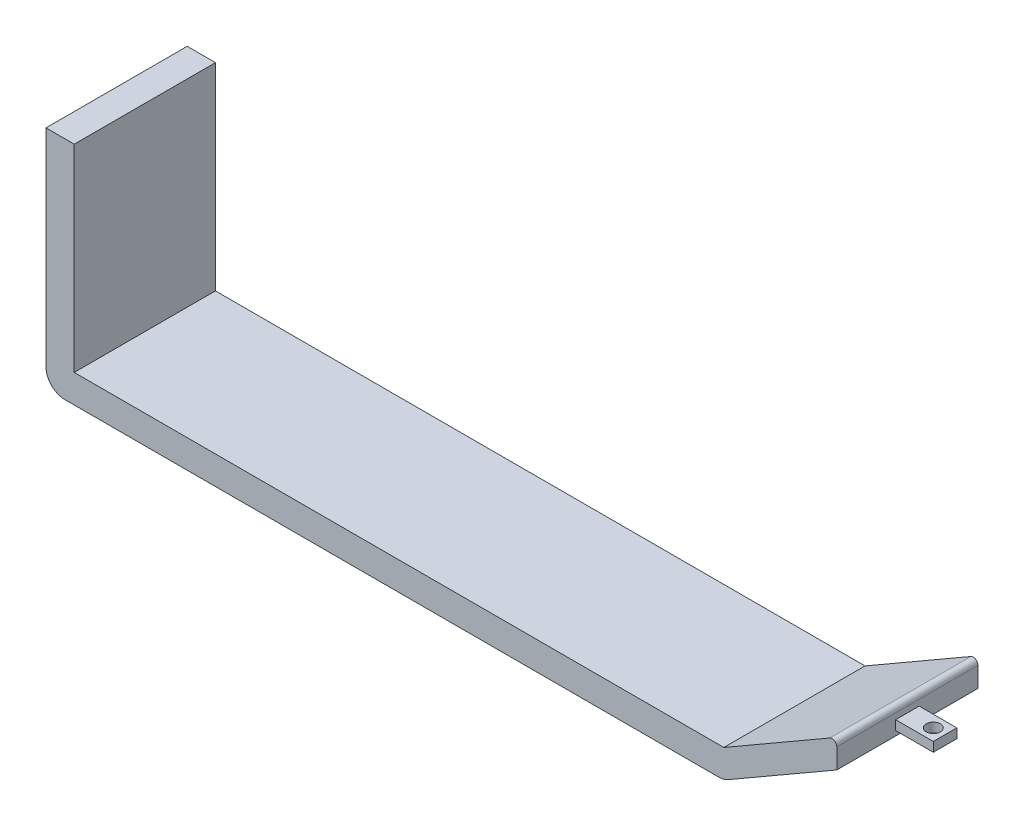
from build123d import *

# Parameters (mm, degrees)
BOSS_EXTRUDE1_DEPTH = 381
SKETCH5_W           = 63.5
SKETCH5_H           = 25.4
BOSS_EXTRUDE4_DEPTH = 101.6
SKETCH6_R           = 19.05
CUT_EXTRUDE3_DEPTH  = 25.4
FILLET3_R           = 50.8
FILLET4_R           = 12.7
FILLET5_R           = 50.8
SKETCH7_W           = 63.5
SKETCH7_H           = 25.4
BOSS_EXTRUDE5_DEPTH = 101.6
SKETCH8_R           = 19.05
CUT_EXTRUDE4_DEPTH  = 25.4


with BuildPart() as part:
    # Sketch1 → Boss-Extrude1 (new body)
    with BuildSketch(Plane.XY):
        Polygon((0, 7.775510204), (0, 0), (6.220408163, 0), (1828.8, 0), (2133.6, 175.976362049), (2133.6, 252.176362049), (1828.8, 76.2), (76.2, 76.2), (76.2, 609.6), (0, 609.6), align=None)
    extrude(amount=BOSS_EXTRUDE1_DEPTH)

    # Sketch5 → Boss-Extrude4 (add)
    with BuildSketch(Plane.ZY):
        with Locations((190.5, 63.5)):
            Rectangle(SKETCH5_W, SKETCH5_H)
    extrude(amount=BOSS_EXTRUDE4_DEPTH)

    # Sketch6 → Cut-Extrude3 (cut)
    with BuildSketch(Plane(origin=(0, 76.2, 0), x_dir=(1, 0, 0), z_dir=(0, 1, 0))):
        with Locations(Location((-63.5, -190.5, 0), (0, 0, 270))):
            Circle(SKETCH6_R)
    extrude(amount=-CUT_EXTRUDE3_DEPTH, mode=Mode.SUBTRACT)

    # Fillet3
    fillet3_edges = [part.edges().sort_by_distance(p)[0] for p in [
        (1828.8, 0, 190.5),
    ]]
    fillet(fillet3_edges, radius=FILLET3_R)

    # Fillet4
    fillet4_edges = [part.edges().sort_by_distance(p)[0] for p in [
        (2133.6, 252.176362049, 190.5),
    ]]
    fillet(fillet4_edges, radius=FILLET4_R)

    # Fillet5
    fillet5_edges = [part.edges().sort_by_distance(p)[0] for p in [
        (0, 0, 190.5),
    ]]
    fillet(fillet5_edges, radius=FILLET5_R - 0.0001)  # a hair under: the kernel refuses the full size

    # Sketch7 → Boss-Extrude5 (add)
    with BuildSketch(Plane(origin=(2133.6, 0, 0), x_dir=(0, 0, -1), z_dir=(1, 0, 0))):
        with Locations((-190.5, 201.376362049)):
            Rectangle(SKETCH7_W, SKETCH7_H)
    extrude(amount=BOSS_EXTRUDE5_DEPTH)

    # Sketch8 → Cut-Extrude4 (cut)
    with BuildSketch(Plane(origin=(0, 214.076362049, 0), x_dir=(1, 0, 0), z_dir=(0, 1, 0))):
        with Locations(Location((2203.45, -190.5, 0), (0, 0, 180))):
            Circle(SKETCH8_R)
    extrude(amount=-CUT_EXTRUDE4_DEPTH, mode=Mode.SUBTRACT)


solid = part.part
